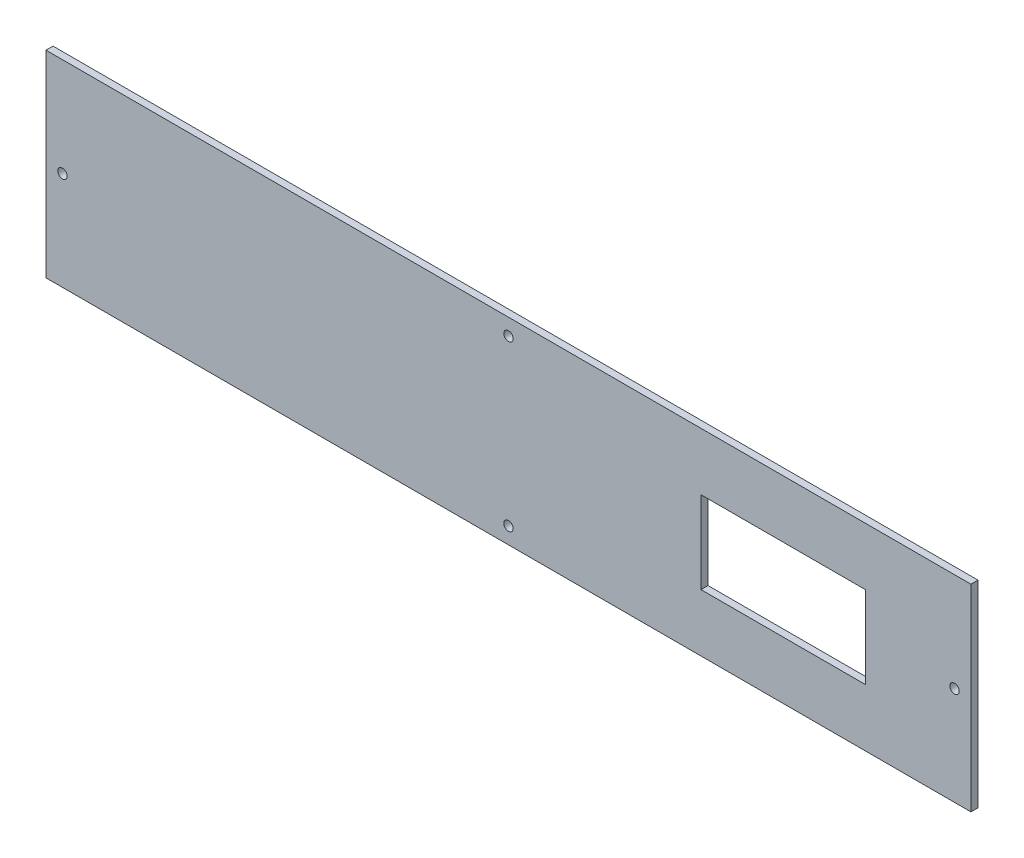
from build123d import *

# Parameters (mm, degrees)
SCHIZZO1_W                   = 394
SCHIZZO1_H                   = 84
SCHIZZO1_R                   = 2
SCHIZZO1_W_2                 = 70
SCHIZZO1_H_2                 = 35
ESTRUSIONE_ESTRUSIONE1_DEPTH = 3


with BuildPart() as part:
    # Schizzo1 → Estrusione-Estrusione1 (new body)
    with BuildSketch(Plane.XY):
        with Locations((197, 42)):
            Rectangle(SCHIZZO1_W, SCHIZZO1_H)
        with Locations((7, 42)):
            Circle(SCHIZZO1_R, mode=Mode.SUBTRACT)
        with Locations((197, 77)):
            Circle(SCHIZZO1_R, mode=Mode.SUBTRACT)
        with Locations((197, 7)):
            Circle(SCHIZZO1_R, mode=Mode.SUBTRACT)
        with Locations((387, 42)):
            Circle(SCHIZZO1_R, mode=Mode.SUBTRACT)
        with Locations((314, 42)):
            Rectangle(SCHIZZO1_W_2, SCHIZZO1_H_2, mode=Mode.SUBTRACT)
    extrude(amount=ESTRUSIONE_ESTRUSIONE1_DEPTH)


solid = part.part
